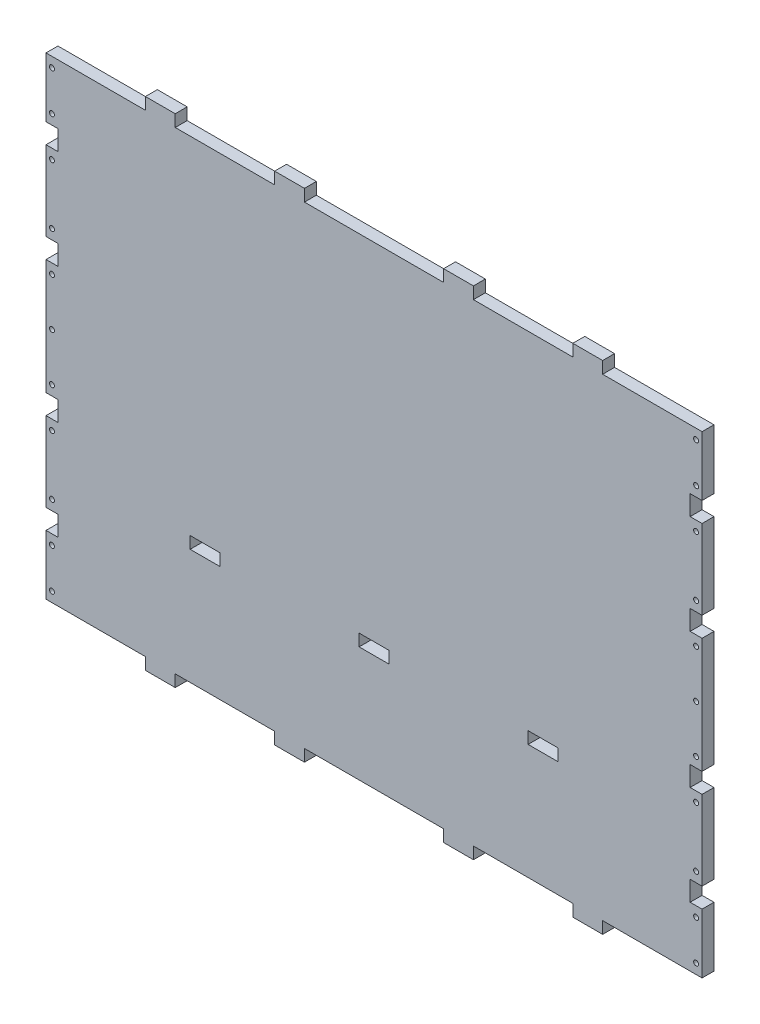
from build123d import *

# Parameters (mm, degrees)
ESQUISSE1_W             = 330
ESQUISSE1_H             = 238
ESQUISSE1_W_2           = 15
ESQUISSE1_H_2           = 6
BOSS_EXTRU_1_DEPTH      = 6
ESQUISSE2_W             = 15
ESQUISSE2_H             = 6
BOSS_EXTRU_2_DEPTH      = 6
ESQUISSE3_W             = 6
ESQUISSE3_H             = 10
ENL_V_MAT_EXTRU_1_DEPTH = 6
ESQUISSE4_R             = 1.25
ENL_V_MAT_EXTRU_2_DEPTH = 6


with BuildPart() as part:
    # Esquisse1 → Boss.-Extru.1 (new body)
    with BuildSketch(Plane.XY):
        Rectangle(ESQUISSE1_W, ESQUISSE1_H)
        with Locations((-85, -58)):
            Rectangle(ESQUISSE1_W_2, ESQUISSE1_H_2, mode=Mode.SUBTRACT)
        with Locations((0, -58)):
            Rectangle(ESQUISSE1_W_2, ESQUISSE1_H_2, mode=Mode.SUBTRACT)
        with Locations((85, -58)):
            Rectangle(ESQUISSE1_W_2, ESQUISSE1_H_2, mode=Mode.SUBTRACT)
    extrude(amount=BOSS_EXTRU_1_DEPTH)

    # Esquisse2 → Boss.-Extru.2 (add)
    with BuildSketch(Plane.XY.offset(6)):
        with Locations((-107.5, 122)):
            Rectangle(ESQUISSE2_W, ESQUISSE2_H)
        with Locations((107.5, 122)):
            Rectangle(ESQUISSE2_W, ESQUISSE2_H)
        with Locations((42.5, 122)):
            Rectangle(ESQUISSE2_W, ESQUISSE2_H)
        with Locations((-42.5, 122)):
            Rectangle(ESQUISSE2_W, ESQUISSE2_H)
        with Locations((107.5, -122)):
            Rectangle(ESQUISSE2_W, ESQUISSE2_H)
        with Locations((-107.5, -122)):
            Rectangle(ESQUISSE2_W, ESQUISSE2_H)
        with Locations((-42.5, -122)):
            Rectangle(ESQUISSE2_W, ESQUISSE2_H)
        with Locations((42.5, -122)):
            Rectangle(ESQUISSE2_W, ESQUISSE2_H)
    extrude(amount=-BOSS_EXTRU_2_DEPTH)

    # Esquisse3 → Enlèv. mat.-Extru.1 (cut)
    with BuildSketch(Plane.XY.offset(6)):
        with Locations((-162, 84)):
            Rectangle(ESQUISSE3_W, ESQUISSE3_H)
        with Locations((-162, 34)):
            Rectangle(ESQUISSE3_W, ESQUISSE3_H)
        with Locations((-162, -34)):
            Rectangle(ESQUISSE3_W, ESQUISSE3_H)
        with Locations((-162, -84)):
            Rectangle(ESQUISSE3_W, ESQUISSE3_H)
        with Locations((162, -84)):
            Rectangle(ESQUISSE3_W, ESQUISSE3_H)
        with Locations((162, -34)):
            Rectangle(ESQUISSE3_W, ESQUISSE3_H)
        with Locations((162, 34)):
            Rectangle(ESQUISSE3_W, ESQUISSE3_H)
        with Locations((162, 84)):
            Rectangle(ESQUISSE3_W, ESQUISSE3_H)
    extrude(amount=-ENL_V_MAT_EXTRU_1_DEPTH, mode=Mode.SUBTRACT)

    # Esquisse4 → Enlèv. mat.-Extru.2 (cut)
    with BuildSketch(Plane.XY.offset(6)):
        with Locations((-162, 114)):
            Circle(ESQUISSE4_R)
        with Locations((-162, 94)):
            Circle(ESQUISSE4_R)
        with Locations((-162, 74)):
            Circle(ESQUISSE4_R)
        with Locations((-162, 44)):
            Circle(ESQUISSE4_R)
        with Locations((-162, 24)):
            Circle(ESQUISSE4_R)
        with Locations((-162, 0)):
            Circle(ESQUISSE4_R)
        with Locations((-162, -24)):
            Circle(ESQUISSE4_R)
        with Locations((-162, -44)):
            Circle(ESQUISSE4_R)
        with Locations((-162, -74)):
            Circle(ESQUISSE4_R)
        with Locations((-162, -94)):
            Circle(ESQUISSE4_R)
        with Locations((-162, -114)):
            Circle(ESQUISSE4_R)
        with Locations((162, -114)):
            Circle(ESQUISSE4_R)
        with Locations((162, -94)):
            Circle(ESQUISSE4_R)
        with Locations((162, -74)):
            Circle(ESQUISSE4_R)
        with Locations((162, -44)):
            Circle(ESQUISSE4_R)
        with Locations((162, -24)):
            Circle(ESQUISSE4_R)
        with Locations((162, 0)):
            Circle(ESQUISSE4_R)
        with Locations((162, 24)):
            Circle(ESQUISSE4_R)
        with Locations((162, 44)):
            Circle(ESQUISSE4_R)
        with Locations((162, 74)):
            Circle(ESQUISSE4_R)
        with Locations((162, 94)):
            Circle(ESQUISSE4_R)
        with Locations((162, 114)):
            Circle(ESQUISSE4_R)
    extrude(amount=-ENL_V_MAT_EXTRU_2_DEPTH, mode=Mode.SUBTRACT)


solid = part.part
